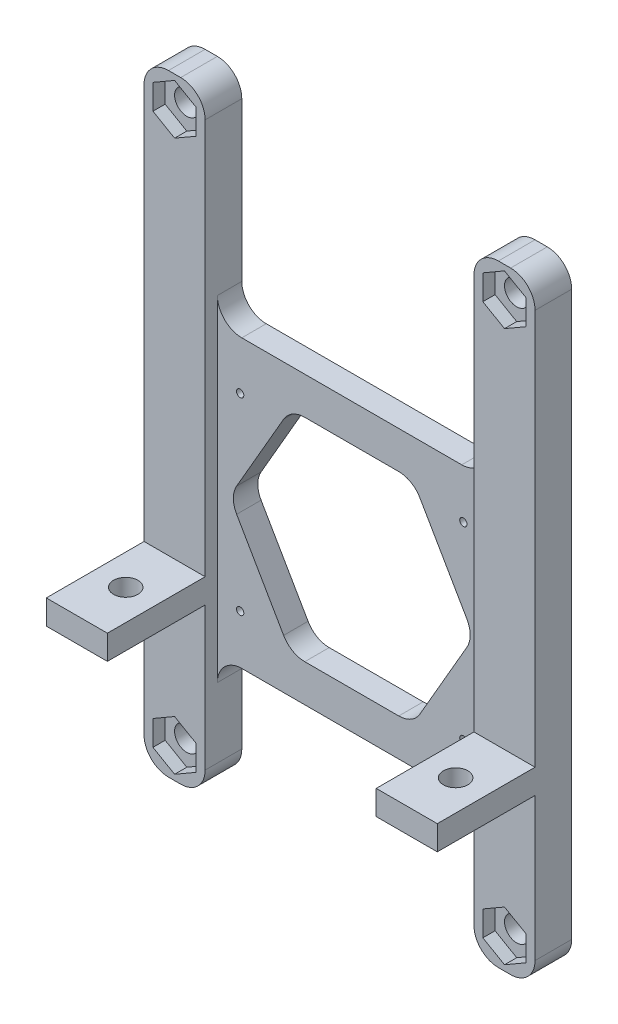
from build123d import *

# Parameters (mm, degrees)
SKETCH1_R           = 0.95
SKETCH1_R_2         = 3.175
BOSS_EXTRUDE1_DEPTH = 6.35
SKETCH2_W           = 15.875
SKETCH2_H           = 159.01875
BOSS_EXTRUDE2_DEPTH = 3.175
SKETCH3_W           = 15.875
SKETCH3_H           = 6.35
BOSS_EXTRUDE3_DEPTH = 25.4
SKETCH4_R           = 3.175
CUT_EXTRUDE1_DEPTH  = 131.930559221
FILLET2_R           = 6.35


with BuildPart() as part:
    # Sketch1 → Boss-Extrude1 (new body)
    with BuildSketch(Plane.XY):
        Polygon((-50.8, -79.509375), (-50.8, 79.509375), (-34.925, 79.509375), (-34.925, 25.7), (34.925, 25.7), (34.925, 79.509375), (50.8, 79.509375), (50.8, -79.509375), (34.925, -79.509375), (34.925, -48.7), (-34.925, -48.7), (-34.925, -79.509375), align=None)
        with Locations((29, 13)):
            Circle(SKETCH1_R, mode=Mode.SUBTRACT)
        with Locations((29, -36)):
            Circle(SKETCH1_R, mode=Mode.SUBTRACT)
        with Locations((-29, -36)):
            Circle(SKETCH1_R, mode=Mode.SUBTRACT)
        with Locations((-29, 13)):
            Circle(SKETCH1_R, mode=Mode.SUBTRACT)
        with Locations((-42.8625, 71.571875)):
            Circle(SKETCH1_R_2, mode=Mode.SUBTRACT)
        with Locations((42.8625, 71.571875)):
            Circle(SKETCH1_R_2, mode=Mode.SUBTRACT)
        with Locations((-42.8625, -71.571875)):
            Circle(SKETCH1_R_2, mode=Mode.SUBTRACT)
        with Locations((42.8625, -71.571875)):
            Circle(SKETCH1_R_2, mode=Mode.SUBTRACT)
        Polygon((-15.875, -38.99630657), (15.875, -38.99630657), (31.75, -11.5), (15.875, 15.99630657), (-15.875, 15.99630657), (-31.75, -11.5), align=None, mode=Mode.SUBTRACT)
    extrude(amount=BOSS_EXTRUDE1_DEPTH)

    # Sketch2 → Boss-Extrude2 (add)
    # profile 1 of 2: a face of its own
    with BuildSketch(Plane.XY.offset(6.35)):
        with Locations((-42.8625, 0)):
            Rectangle(SKETCH2_W, SKETCH2_H)
        Polygon((-48.4875, 68.324279736), (-42.8625, 65.076684472), (-37.2375, 68.324279736), (-37.2375, 74.819470264), (-42.8625, 78.067065528), (-48.4875, 74.819470264), align=None, mode=Mode.SUBTRACT)
        Polygon((-37.2375, -68.324279736), (-42.8625, -65.076684472), (-48.4875, -68.324279736), (-48.4875, -74.819470264), (-42.8625, -78.067065528), (-37.2375, -74.819470264), align=None, mode=Mode.SUBTRACT)
    # profile 2 of 2: a face of its own
    with BuildSketch(Plane.XY.offset(6.35)):
        with Locations((42.8625, 0)):
            Rectangle(SKETCH2_W, SKETCH2_H)
        Polygon((37.2375, -74.819470264), (37.2375, -68.324279736), (42.8625, -65.076684472), (48.4875, -68.324279736), (48.4875, -74.819470264), (42.8625, -78.067065528), align=None, mode=Mode.SUBTRACT)
        Polygon((48.4875, 74.819470264), (48.4875, 68.324279736), (42.8625, 65.076684472), (37.2375, 68.324279736), (37.2375, 74.819470264), (42.8625, 78.067065528), align=None, mode=Mode.SUBTRACT)
    extrude(amount=BOSS_EXTRUDE2_DEPTH)

    # Sketch3 → Boss-Extrude3 (add)
    with BuildSketch(Plane.XY.offset(9.525)):
        with Locations((-42.8625, -32.825)):
            Rectangle(SKETCH3_W, SKETCH3_H)
        with Locations((42.8625, -32.825)):
            Rectangle(SKETCH3_W, SKETCH3_H)
    extrude(amount=BOSS_EXTRUDE3_DEPTH)

    # Sketch4 → Cut-Extrude1 (cut, through all)
    with BuildSketch(Plane(origin=(0, -36, 0), x_dir=(1, 0, 0), z_dir=(0, 1, 0))):
        with Locations((-42.8625, -22.225)):
            Circle(SKETCH4_R)
        with Locations((42.8625, -22.225)):
            Circle(SKETCH4_R)
    extrude(amount=CUT_EXTRUDE1_DEPTH, mode=Mode.SUBTRACT)

    # Fillet2
    fillet2_edges = [part.edges().sort_by_distance(p)[0] for p in [
        (34.925, -48.7, 3.175),
        (-34.925, -48.7, 3.175),
        (-50.8, -79.509375, 4.7625),
        (-34.925, -79.509375, 4.7625),
        (34.925, -79.509375, 4.7625),
        (50.8, -79.509375, 4.7625),
        (50.8, 79.509375, 4.7625),
        (34.925, 79.509375, 4.7625),
        (34.925, 25.7, 3.175),
        (-34.925, 25.7, 3.175),
        (-34.925, 79.509375, 4.7625),
        (-50.8, 79.509375, 4.7625),
        (-15.875, 15.99630657, 3.175),
        (-31.75, -11.5, 3.175),
        (-15.875, -38.99630657, 3.175),
        (15.875, -38.99630657, 3.175),
        (31.75, -11.5, 3.175),
        (15.875, 15.99630657, 3.175),
    ]]
    fillet(fillet2_edges, radius=FILLET2_R)


solid = part.part
